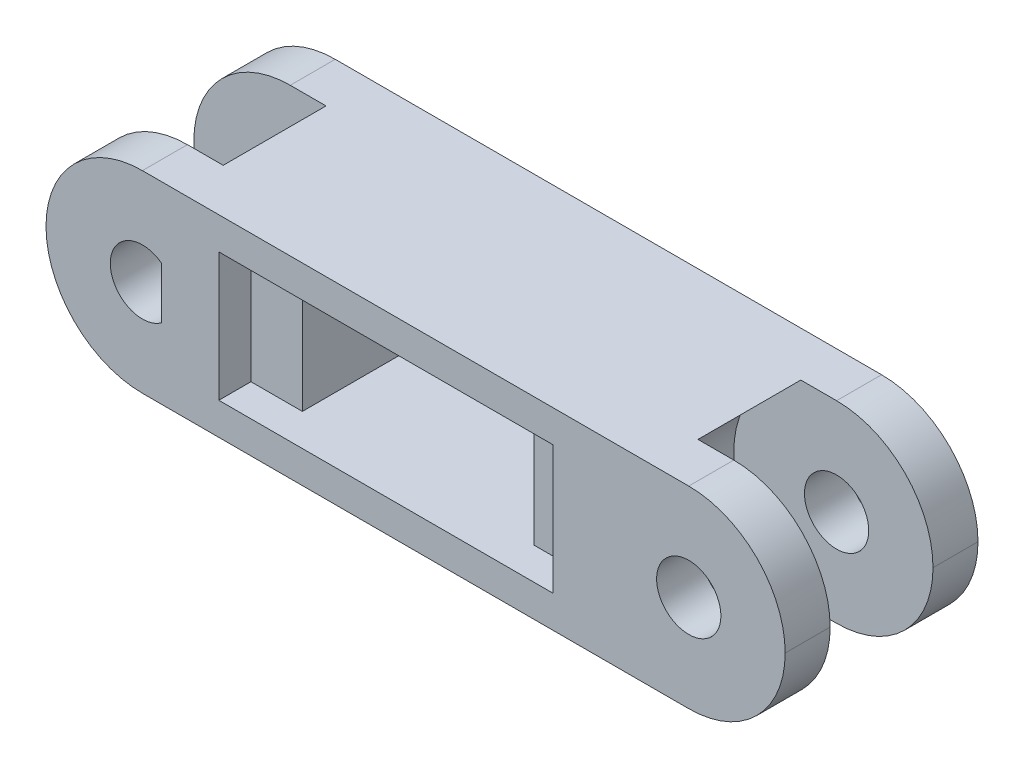
from build123d import *

# Parameters (mm, degrees)
SKETCH1_W               = 63.5
SKETCH1_H               = 19.05
BOSS_EXTRUDE1_DEPTH     = 9.525
FILLET1_R               = 9.525
CUT_EXTRUDE1_DEPTH      = 39.232062788
CUT_EXTRUDE1_DEPTH_BACK = 39.232062788
SKETCH2_R               = 3.175
CUT_EXTRUDE2_DEPTH      = 39.232062788
CUT_EXTRUDE2_DEPTH_BACK = 3.175
SKETCH3_W               = 33.02
SKETCH3_H               = 12.7
SKETCH6_W               = 22.86
SKETCH6_H               = 12.7
CUT_EXTRUDE4_DEPTH      = 39.232062788
SKETCH7_W               = 5.08
SKETCH7_H               = 12.7
CUT_EXTRUDE5_DEPTH      = 9.525
BOSS_EXTRUDE2_DEPTH     = 19.05
CUT_EXTRUDE6_DEPTH      = 47.446245812
SKETCH4_R               = 10.16
CUT_EXTRUDE3_DEPTH      = 5.08


with BuildPart() as part:
    # Sketch1 → Boss-Extrude1 (new, symmetric)
    with BuildSketch(Plane.XY):
        Rectangle(SKETCH1_W, SKETCH1_H)
    extrude(amount=BOSS_EXTRUDE1_DEPTH, both=True)

    # Fillet1
    fillet1_edges = [part.edges().sort_by_distance(p)[0] for p in [
        (31.75, -9.525, 0),
        (31.75, 9.525, 0),
    ]]
    fillet(fillet1_edges, radius=FILLET1_R - 0.0001)  # a hair under: the kernel refuses the full size

    # Sketch2 → Cut-Extrude1 (cut, two sides: drawn at the far end of the back side and taken through both)
    with BuildSketch(Plane.XY.offset(9.525).offset(-CUT_EXTRUDE1_DEPTH_BACK)):
        with Locations((22.225, 0)):
            Circle(SKETCH2_R)
    extrude(amount=CUT_EXTRUDE1_DEPTH + CUT_EXTRUDE1_DEPTH_BACK, mode=Mode.SUBTRACT)

    # Sketch3 → Cut-Extrude2 (cut, two sides: drawn at the far end of the back side and taken through both)
    with BuildSketch(Plane.XY.offset(9.525).offset(-CUT_EXTRUDE2_DEPTH_BACK)):
        with Locations((-7.691525386, 0)):
            Rectangle(SKETCH3_W, SKETCH3_H)
    extrude(amount=CUT_EXTRUDE2_DEPTH + CUT_EXTRUDE2_DEPTH_BACK, mode=Mode.SUBTRACT)

    # Sketch6 → Cut-Extrude4 (cut, through all)
    with BuildSketch(Plane(origin=(0, 0, -9.525), x_dir=(-1, 0, 0), z_dir=(0, 0, -1))):
        with Locations((7.691525386, 0)):
            Rectangle(SKETCH6_W, SKETCH6_H)
    extrude(amount=-CUT_EXTRUDE4_DEPTH, mode=Mode.SUBTRACT)

    # Sketch7 → Cut-Extrude5 (cut)
    with BuildSketch(Plane(origin=(0, 0, -9.525), x_dir=(-1, 0, 0), z_dir=(0, 0, -1))):
        with Locations((-6.278474614, 0)):
            Rectangle(SKETCH7_W, SKETCH7_H)
    extrude(amount=-CUT_EXTRUDE5_DEPTH, mode=Mode.SUBTRACT)

    # Sketch8 → Boss-Extrude2 (add)
    with BuildSketch(Plane.XY.offset(9.525)):
        with BuildLine():
            Line((-31.75, 9.525), (-31.75, -9.525))
            ThreePointArc((-31.75, -9.525), (-41.275, 0), (-31.75, 9.525))
        make_face()
    extrude(amount=-BOSS_EXTRUDE2_DEPTH)

    # Sketch9 → Cut-Extrude6 (cut, through all)
    with BuildSketch(Plane.XY.offset(9.525)):
        with BuildLine():
            Line((-29.845, 2.54), (-29.845, -2.54))
            ThreePointArc((-29.845, -2.54), (-34.925, 0), (-29.845, 2.54))
        make_face()
    extrude(amount=-CUT_EXTRUDE6_DEPTH, mode=Mode.SUBTRACT)

    # Sketch4 → Cut-Extrude3 (cut, symmetric)
    with BuildSketch(Plane.XY):
        with Locations((22.225, 0)):
            Circle(SKETCH4_R)
        with Locations((-31.75, 0)):
            Circle(SKETCH4_R)
    extrude(amount=CUT_EXTRUDE3_DEPTH, both=True, mode=Mode.SUBTRACT)


solid = part.part
